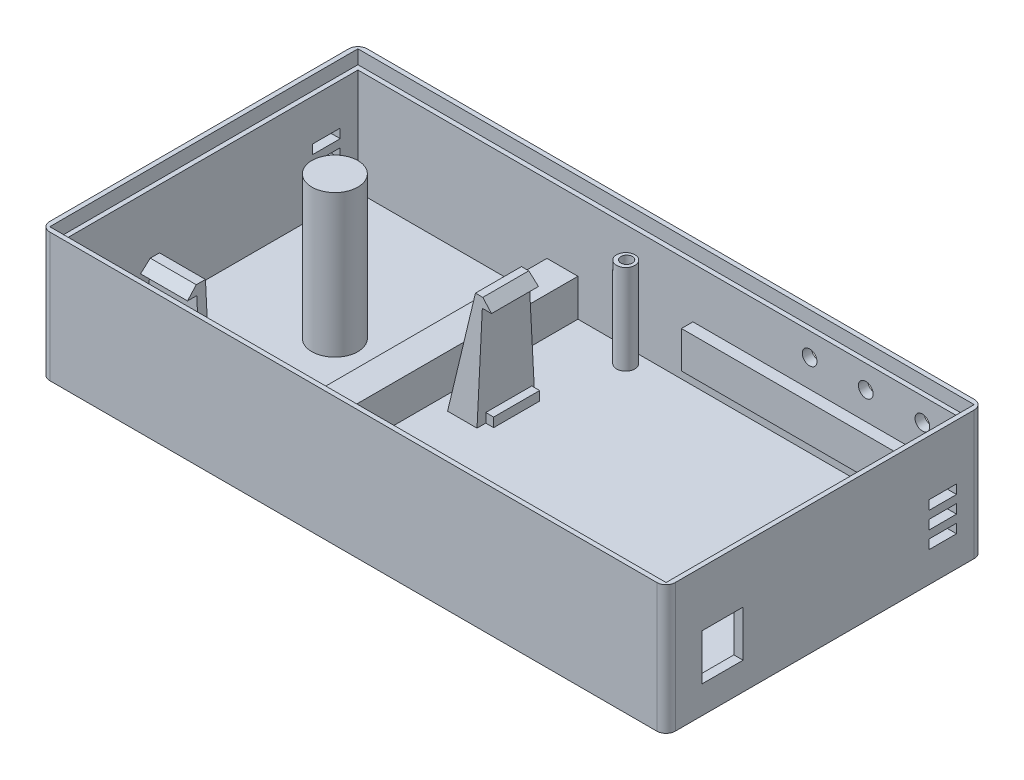
from build123d import *

# Parameters (mm, degrees)
SKETCH_2_W                  = 132
SKETCH_2_H                  = 65
EXTRUDE_2_DEPTH             = 2
SKETCH_2_3_W                = 132
SKETCH_2_3_H                = 65
EXTRUDE_3_DEPTH             = 25
SKETCH_4_R                  = 0.95
SKETCH_4_R_2                = 2
EXTRUDE_4_DEPTH             = 19.5
SKETCH_9_W                  = 6
SKETCH_9_H                  = 2
CUT_EXTRUDE_1_DEPTH         = 23
SKETCH_5_W                  = 8.9
SKETCH_5_H                  = 10
SKETCH_5_W_2                = 6
SKETCH_5_H_2                = 2
CUT_EXTRUDE_2_DEPTH         = 2
SKETCH_11_W                 = 2
SKETCH_11_H                 = 6
CUT_EXTRUDE_3_DEPTH         = 23
SKETCH_12_R                 = 1.6
CUT_EXTRUDE_4_DEPTH         = 23
HOLE_WIZARD_M3_3_D          = 2.5
HOLE_WIZARD_M3_3_DEPTH      = 8.5
HOLE_WIZARD_M3_3_TIP        = 0.751075774
SKETCH_24_W                 = 134
SKETCH_24_H                 = 67
EXTRUDE_5_DEPTH             = 3
SKETCH_25_R                 = 5
EXTRUDE_6_DEPTH             = 31
MACRO_START                 = 30.5
MACRO_FEATURE_1_DEPTH       = 4
MACRO_FEATURE_1_2_DEPTH     = 2
MACRO_START_2               = 45.608387387
MACRO_FEATURE_1_3_OUTLINE_W = 13
MACRO_FEATURE_1_3_OUTLINE_H = 6
MACRO_FEATURE_1_3_DEPTH     = 2.391612613
SKETCH_28_W                 = 4
SKETCH_28_H                 = 10
EXTRUDE_7_DEPTH             = 2
MACRO_START_3               = -10.52248
MACRO_FEATURE_2_DEPTH       = 1.905691985
MACRO_START_4               = -10.216788015
MACRO_FEATURE_2_2_DEPTH     = 1.6
MACRO_START_5               = -13.52599806
MACRO_FEATURE_2_3_DEPTH     = 12.515573406
MACRO_START_6               = -12.373026916
MACRO_FEATURE_2_4_DEPTH     = 10.209631117
MACRO_START_7               = -16
MACRO_FEATURE_2_5_DEPTH     = 10
SKETCH_32_W                 = 59.163412992
SKETCH_32_H                 = 8
EXTRUDE_9_DEPTH             = 2.5
EXTRUDE_10_REACH            = 103.005
SKETCH_31_W                 = 6.738210925
SKETCH_31_H                 = 8.083848138


with BuildPart() as part:
    # 草图2 → 凸台-拉伸2 (new body)
    with BuildSketch(Plane(origin=(0, 0, 0), x_dir=(1, 0, 0), z_dir=(0, 1, 0))):
        Rectangle(SKETCH_2_W, SKETCH_2_H)
    extrude(amount=EXTRUDE_2_DEPTH)

    # 草图2<3> → 凸台-拉伸3 (add)
    with BuildSketch(Plane(origin=(0, 0, 0), x_dir=(1, 0, 0), z_dir=(0, 1, 0))):
        with BuildLine():
            Line((-66, 34.5), (66, 34.5))
            ThreePointArc((66, 34.5), (67.414213562, 33.914213562), (68, 32.5))
            Line((68, 32.5), (68, -32.5))
            ThreePointArc((68, -32.5), (67.414213562, -33.914213562), (66, -34.5))
            Line((66, -34.5), (-66, -34.5))
            ThreePointArc((-66, -34.5), (-67.414213562, -33.914213562), (-68, -32.5))
            Line((-68, -32.5), (-68, 32.5))
            ThreePointArc((-68, 32.5), (-67.414213562, 33.914213562), (-66, 34.5))
        make_face()
        Rectangle(SKETCH_2_3_W, SKETCH_2_3_H, mode=Mode.SUBTRACT)
    extrude(amount=EXTRUDE_3_DEPTH)

    # 草图4 → 凸台-拉伸4 (add)
    with BuildSketch(Plane(origin=(0, 2, 0), x_dir=(1, 0, 0), z_dir=(0, 1, 0))):
        with Locations(Location((63.7, 29.33, 0), (0, 0, 90))):
            Circle(SKETCH_4_R)
        with Locations(Location((63.7, -30.23, 0), (0, 0, 90))):
            Circle(SKETCH_4_R)
        with Locations(Location((-4.6, 29.33, 0), (0, 0, 90))):
            Circle(SKETCH_4_R_2)
        with Locations(Location((-4.6, -30.23, 0), (0, 0, 90))):
            Circle(SKETCH_4_R)
    extrude(amount=EXTRUDE_4_DEPTH)

    # 草图9 → 切除-拉伸1 (cut)
    with BuildSketch(Plane.ZY.offset(68)):
        with Locations((-25.652476361, 14.999984766)):
            Rectangle(SKETCH_9_W, SKETCH_9_H)
        with Locations((-25.652476361, 11.299984766)):
            Rectangle(SKETCH_9_W, SKETCH_9_H)
        with Locations((-25.652476361, 7.599984766)):
            Rectangle(SKETCH_9_W, SKETCH_9_H)
    extrude(amount=-CUT_EXTRUDE_1_DEPTH, mode=Mode.SUBTRACT)

    # 草图5 → 切除-拉伸2 (cut)
    with BuildSketch(Plane(origin=(68, 0, 0), x_dir=(0, 0, -1), z_dir=(1, 0, 0))):
        with Locations((-22.21, 11)):
            Rectangle(SKETCH_5_W, SKETCH_5_H)
        with Locations((25.652457488, 15)):
            Rectangle(SKETCH_5_W_2, SKETCH_5_H_2)
        with Locations((25.652457488, 11.3)):
            Rectangle(SKETCH_5_W_2, SKETCH_5_H_2)
        with Locations((25.652457488, 7.6)):
            Rectangle(SKETCH_5_W_2, SKETCH_5_H_2)
    extrude(amount=-CUT_EXTRUDE_2_DEPTH, mode=Mode.SUBTRACT)

    # 草图11 → 切除-拉伸3 (cut)
    with BuildSketch(Plane.XZ):
        with Locations((-42.109364057, 26.5)):
            Rectangle(SKETCH_11_W, SKETCH_11_H)
        with Locations((-45.609364057, 26.5)):
            Rectangle(SKETCH_11_W, SKETCH_11_H)
        with Locations((-49.109364057, 26.5)):
            Rectangle(SKETCH_11_W, SKETCH_11_H)
        with Locations((-52.609364057, 26.5)):
            Rectangle(SKETCH_11_W, SKETCH_11_H)
        with Locations((-56.109364057, 26.5)):
            Rectangle(SKETCH_11_W, SKETCH_11_H)
        with Locations((-59.609364057, 26.5)):
            Rectangle(SKETCH_11_W, SKETCH_11_H)
    extrude(amount=-CUT_EXTRUDE_3_DEPTH, mode=Mode.SUBTRACT)

    # 草图12 → 切除-拉伸4 (cut)
    with BuildSketch(Plane(origin=(0, 0, -34.5), x_dir=(-1, 0, 0), z_dir=(0, 0, -1))):
        with Locations((-56.73, 20)):
            Circle(SKETCH_12_R)
        with Locations((-44.42, 20)):
            Circle(SKETCH_12_R)
        with Locations((-32.22, 20)):
            Circle(SKETCH_12_R)
    extrude(amount=-CUT_EXTRUDE_4_DEPTH, mode=Mode.SUBTRACT)

    # M3 螺纹孔3
    with Locations(Plane(origin=(0, 21.5, 0), x_dir=(1, 0, 0), z_dir=(0, 1, 0))):
        with Locations((-4.555471055, 29.483622127)):
            Hole(HOLE_WIZARD_M3_3_D / 2, depth=HOLE_WIZARD_M3_3_DEPTH)
            with Locations((0, 0, -(HOLE_WIZARD_M3_3_DEPTH + HOLE_WIZARD_M3_3_TIP / 2))):  # 118° drill point
                Cone(0, HOLE_WIZARD_M3_3_D / 2, HOLE_WIZARD_M3_3_TIP, mode=Mode.SUBTRACT)

    # 草图24 → 凸台-拉伸5 (add)
    with BuildSketch(Plane(origin=(0, 25, 0), x_dir=(1, 0, 0), z_dir=(0, 1, 0))):
        with BuildLine():
            Line((66, -34.5), (-66, -34.5))
            ThreePointArc((-66, -34.5), (-67.414213562, -33.914213562), (-68, -32.5))
            Line((-68, -32.5), (-68, 32.5))
            ThreePointArc((-68, 32.5), (-67.414213562, 33.914213562), (-66, 34.5))
            Line((-66, 34.5), (66, 34.5))
            ThreePointArc((66, 34.5), (67.414213562, 33.914213562), (68, 32.5))
            Line((68, 32.5), (68, -32.5))
            ThreePointArc((68, -32.5), (67.414213562, -33.914213562), (66, -34.5))
        make_face()
        Rectangle(SKETCH_24_W, SKETCH_24_H, mode=Mode.SUBTRACT)
    extrude(amount=EXTRUDE_5_DEPTH)

    # 草图25 → 凸台-拉伸6 (add)
    with BuildSketch(Plane(origin=(0, 2, 0), x_dir=(1, 0, 0), z_dir=(0, 1, 0))):
        with Locations(Location((-40.969280892, 2.451986174, 0), (0, 0, 90))):
            Circle(SKETCH_25_R)
    extrude(amount=EXTRUDE_6_DEPTH)



with BuildPart() as body_2:
    # Macro Feature 1: read off the stored shape, not the designer's step
    # Macro Feature 1 outline → Macro Feature 1 (new body)
    with BuildSketch(Plane.XY.offset(MACRO_START)):
        Polygon((-36.152325447, 32), (-46.152325447, 32), (-46.257141006, 30), (-36.047509888, 30), align=None)
    extrude(amount=MACRO_FEATURE_1_DEPTH)


with BuildPart() as part_1:
    add(part.part)

    add(body_2.part)  # Macro Feature 1 2 merges body 2
    # Macro Feature 1 2 outline → Macro Feature 1 2 (add)
    with BuildSketch(Plane.XY.offset(MACRO_START)):
        Polygon((-36.047509888, 30), (-46.257141006, 30), (-47.724558825, 2), (-34.580092068, 2), align=None)
    extrude(amount=MACRO_FEATURE_1_2_DEPTH)

    # Macro Feature 1 3 outline → Macro Feature 1 3 (cut)
    with BuildSketch(Plane(origin=(0, 0, 0), x_dir=(1, 0, 0), z_dir=(0, 0.707106781186547, 0.707106781186548)).offset(MACRO_START_2)):
        with Locations((-41.5, -2)):
            Rectangle(MACRO_FEATURE_1_3_OUTLINE_W, MACRO_FEATURE_1_3_OUTLINE_H)
    extrude(amount=MACRO_FEATURE_1_3_DEPTH, mode=Mode.SUBTRACT)

    # 草图28 → 凸台-拉伸7 (add)
    with BuildSketch(Plane(origin=(0, 2, 0), x_dir=(1, 0, 0), z_dir=(0, 1, 0))):
        with Locations((-8.9, 7.909574936)):
            Rectangle(SKETCH_28_W, SKETCH_28_H)
    extrude(amount=EXTRUDE_7_DEPTH)

    # Macro Feature 2: read off the stored shape, not the designer's step
    # Macro Feature 2 outline → Macro Feature 2 (add)
    with BuildSketch(Plane.YZ.offset(MACRO_START_3)):
        Polygon((2, -12.909574936), (2, -13.52599806), (24, -12.373026916), (24, -2.163395799), (2, -1.010424654), (2, -2.909574936), (4, -2.909574936), (4, -12.909574936), align=None)
    extrude(amount=MACRO_FEATURE_2_DEPTH)

    # Macro Feature 2 2 outline → Macro Feature 2 2 (add)
    with BuildSketch(Plane.YZ.offset(MACRO_START_4)):
        Polygon((24, -2.163395799), (24, -12.373026916), (26, -12.268211357), (26, -2.268211357), align=None)
    extrude(amount=MACRO_FEATURE_2_2_DEPTH)

    # Macro Feature 2 3 outline → Macro Feature 2 3 (add)
    with BuildSketch(Plane.XY.offset(MACRO_START_5)):
        Polygon((-10.216788015, 24), (-10.216788015, 26), (-15.016788015, 2), (-10.52248, 2), (-10.52248, 24), align=None)
    extrude(amount=MACRO_FEATURE_2_3_DEPTH)

    # Macro Feature 2 4 outline → Macro Feature 2 4 (add)
    with BuildSketch(Plane.XY.offset(MACRO_START_6)):
        Polygon((-8.616788015, 26), (-8.616788015, 24), (-6.616788015, 24), align=None)
    extrude(amount=MACRO_FEATURE_2_4_DEPTH)

    # Macro Feature 2 5 outline → Macro Feature 2 5 (cut)
    with BuildSketch(Plane.YZ.offset(MACRO_START_7)):
        Polygon((2, -13.52599806), (27, -13.52599806), (27, -12.215803578), (26, -12.268211357), align=None)
        Polygon((26, -2.268211357), (27, -2.320619136), (27, -1.010424654), (2, -1.010424654), align=None)
    extrude(amount=MACRO_FEATURE_2_5_DEPTH, mode=Mode.SUBTRACT)

    # 草图32 → 凸台-拉伸9 (add)
    with BuildSketch(Plane.XY.offset(-32.5)):
        with Locations((36.418293504, 10)):
            Rectangle(SKETCH_32_W, SKETCH_32_H)
    extrude(amount=EXTRUDE_9_DEPTH)

    # 草图31 → 凸台-拉伸10 (add, up to next)
    with BuildSketch(Plane(origin=(0, 0, 32.5), x_dir=(-1, 0, 0), z_dir=(0, 0, -1)), mode=Mode.PRIVATE) as extrude_10_sk1:
        with Locations((21.534982766, 6.041924069)):
            Rectangle(SKETCH_31_W, SKETCH_31_H)
    extrude_10_tool1 = extrude(extrude_10_sk1.sketch, amount=EXTRUDE_10_REACH, mode=Mode.PRIVATE) - part_1.part
    add(extrude_10_tool1.solids().sort_by_distance((-21.534983, 6.041924, 32.5))[0])


solid = part_1.part
